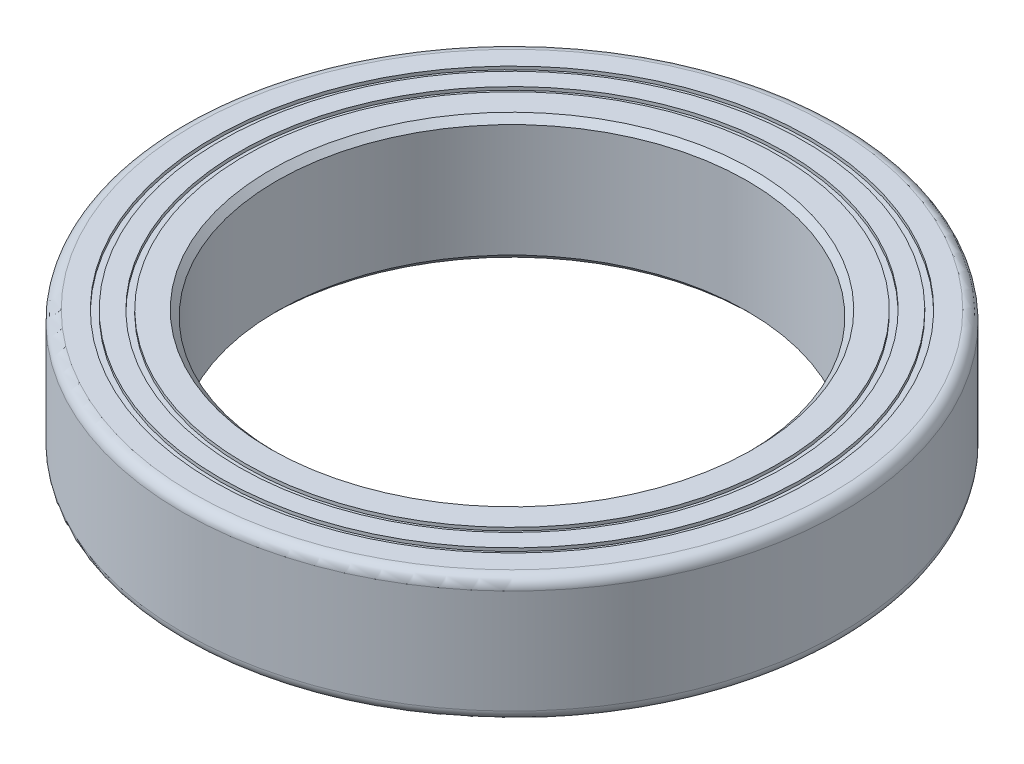
from build123d import *

# Parameters (mm, degrees)
FILLET2_R     = 0.344
CHAMFER2_SIZE = 0.2


with BuildPart() as part:
    # Sketch1 → Revolve1 (revolve)
    with BuildSketch(Plane.XY):
        Polygon((10.5, 0), (10.5, 4), (9.5, 4), (9.5, 3.9), (9.3, 3.9), (9.3, 4), (8.7, 4), (8.7, 3.9), (8.5, 3.9), (8.5, 4), (7.5, 4), (7.5, 0), (8.5, 0), (8.5, 0.1), (8.7, 0.1), (8.7, 0), (9.3, 0), (9.3, 0.1), (9.5, 0.1), (9.5, 0), align=None)
    revolve(axis=Axis((0, 2, 0), (0, -1, 0)))

    # Fillet2
    fillet2_edges = [part.edges().sort_by_distance(p)[0] for p in [
        (-10.5, 0, 0),
        (-10.5, 4, 0),
    ]]
    fillet(fillet2_edges, radius=FILLET2_R)

    # Chamfer2
    chamfer2_edges = [part.edges().sort_by_distance(p)[0] for p in [
        (-7.5, 0, 0),
        (-7.5, 4, 0),
    ]]
    chamfer(chamfer2_edges, length=CHAMFER2_SIZE)


solid = part.part
